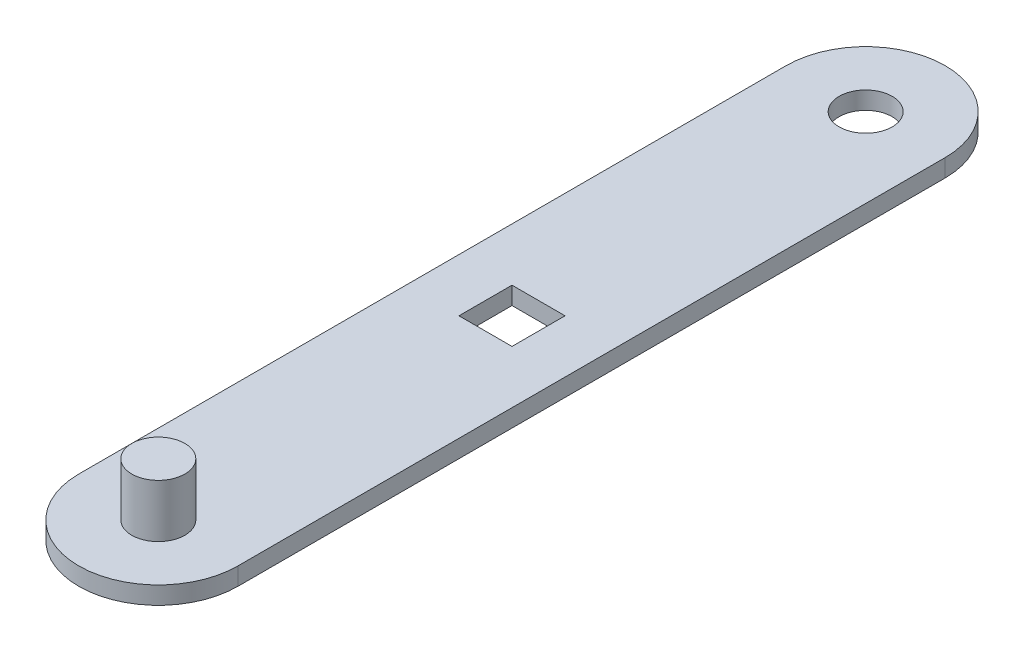
from build123d import *

# Parameters (mm, degrees)
BOSS_EXTRUDE1_DEPTH = 50
SKETCH2_R           = 75
BOSS_EXTRUDE2_DEPTH = 150
SKETCH3_R           = 75
CUT_EXTRUDE2_DEPTH  = 250
SKETCH5_W           = 150
SKETCH5_H           = 150
CUT_EXTRUDE3_DEPTH  = 1255.491929029


with BuildPart() as part:
    # Sketch1 → Boss-Extrude1 (new body)
    with BuildSketch(Plane(origin=(0, 0, 0), x_dir=(1, 0, 0), z_dir=(0, 1, 0))):
        with BuildLine():
            Line((-225, 1000), (-225, -1000))
            ThreePointArc((-225, -1000), (0, -1225), (225, -1000))
            Line((225, -1000), (225, 1000))
            ThreePointArc((225, 1000), (0, 1225), (-225, 1000))
        make_face()
    extrude(amount=BOSS_EXTRUDE1_DEPTH)

    # Sketch2 → Boss-Extrude2 (add)
    with BuildSketch(Plane(origin=(0, 50, 0), x_dir=(1, 0, 0), z_dir=(0, 1, 0))):
        with Locations((0, -1000)):
            Circle(SKETCH2_R)
    extrude(amount=BOSS_EXTRUDE2_DEPTH)

    # Sketch3 → Cut-Extrude2 (cut)
    with BuildSketch(Plane(origin=(0, 50, 0), x_dir=(1, 0, 0), z_dir=(0, 1, 0))):
        with Locations((0, 1000)):
            Circle(SKETCH3_R)
    extrude(amount=-CUT_EXTRUDE2_DEPTH, mode=Mode.SUBTRACT)

    # Sketch5 → Cut-Extrude3 (cut, through all)
    with BuildSketch(Plane(origin=(0, 50, 0), x_dir=(1, 0, 0), z_dir=(0, 1, 0))):
        Rectangle(SKETCH5_W, SKETCH5_H)
    extrude(amount=-CUT_EXTRUDE3_DEPTH, mode=Mode.SUBTRACT)


solid = part.part
